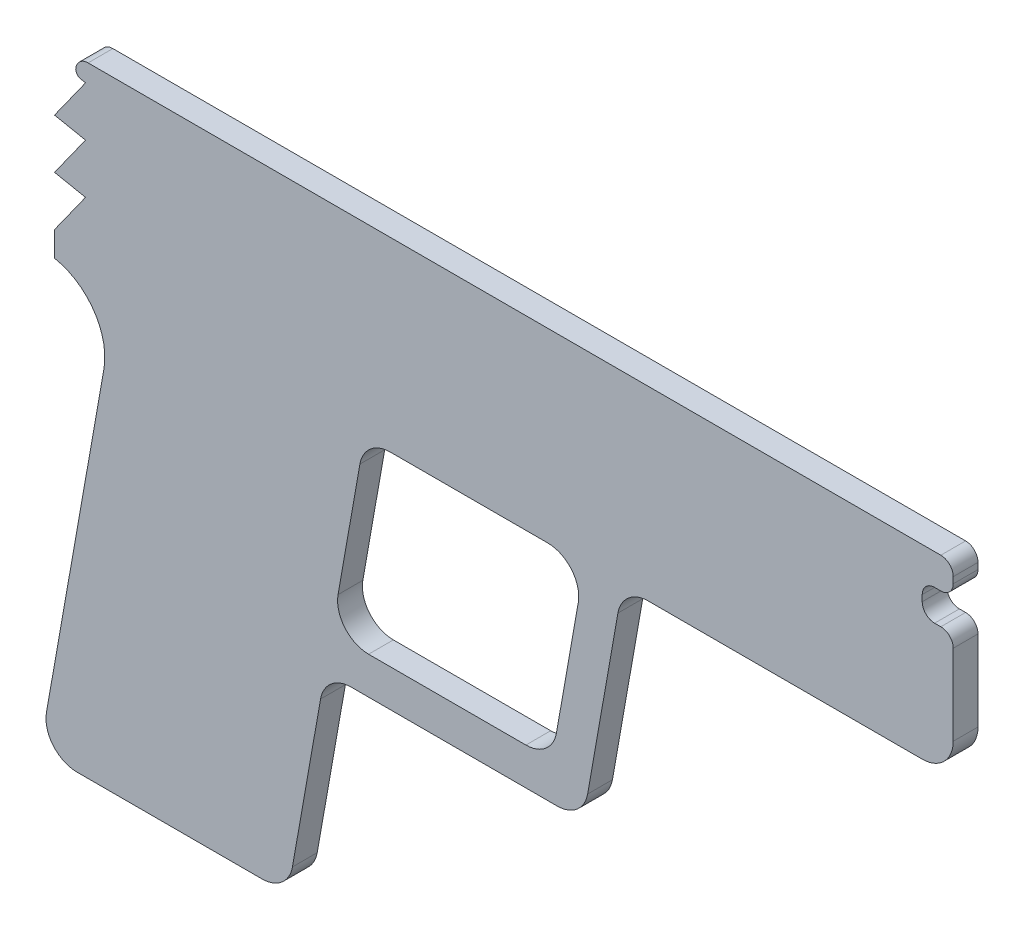
from build123d import *

# Parameters (mm, degrees)
BOSS_EXTRUDE1_DEPTH = 4
FILLET1_R           = 10
FILLET2_R           = 5
CUT_EXTRUDE1_DEPTH  = 4
LPATTERN1_COUNT     = 3
LPATTERN1_PITCH     = 8
FILLET3_R           = 2
FILLET4_R           = 2
CUT_EXTRUDE2_DEPTH  = 10
FILLET5_R           = 2
FILLET6_R           = 1


with BuildPart() as part:
    # Sketch1 → Boss-Extrude1 (new body)
    with BuildSketch(Plane.XY):
        Polygon((10, 0), (-2.34288865, -70), (37.65711135, -70), (43.652228694, -36), (85.284719782, -36), (91.632491087, 0), (145, 0), (145, 20), (140, 20), (140, 25), (145, 25), (145, 30), (0, 30), (0, 0), align=None)
        Polygon((44.710190579, -30), (80.250121995, -30), (85.539931416, 0), (50, 0), align=None, mode=Mode.SUBTRACT)
    extrude(amount=BOSS_EXTRUDE1_DEPTH)

    # Fillet1
    # the kernel refuses this fillet: 10 mm, written as the material it adds along each edge
    with BuildSketch(Plane(origin=(10, 0, 0), x_dir=(-0.17364817766693433, -0.9848077530122074, 0), z_dir=(0, 0, 1))) as fillet1_piece_1:
        with BuildLine():
            CenterArc((11.735327688, -10), FILLET1_R, 90, 89.129514879)
            Line((1.736481777, -9.84807753), (1.536504858, -9.845039081))
            ThreePointArc((1.536504858, -9.845039081), (0.671279338, -4.958768401), (-0.196961551, -0.034729636))
            Line((-0.196961551, -0.034729636), (0, 0.2))
            Line((0, 0.2), (11.735327688, 0.2))
            Line((11.735327688, 0.2), (11.735327688, 0))
        make_face()
    extrude(amount=4)

    # Fillet2
    fillet2_edges = [part.edges().sort_by_distance(p)[0] for p in [
        (145, 0, 2),
        (91.632491087, 0, 2),
        (85.284719782, -36, 2),
        (43.652228694, -36, 2),
        (37.65711135, -70, 2),
        (-2.34288865, -70, 2),
        (85.539931416, 0, 2),
        (50, 0, 2),
        (44.710190579, -30, 2),
        (80.250121995, -30, 2),
    ]]
    fillet(fillet2_edges, radius=FILLET2_R)

    # Sketch2 → Cut-Extrude1 (cut)
    with BuildSketch(Plane.XY.offset(4)):
        Polygon((0, 20), (0, 28), (5, 27), align=None)
    cut_extrude1 = extrude(amount=-CUT_EXTRUDE1_DEPTH, mode=Mode.SUBTRACT)

    # LPattern1: Cut-Extrude1 ×3
    with Locations(*[(0, -i * LPATTERN1_PITCH, 0) for i in range(1, LPATTERN1_COUNT)]):
        add(cut_extrude1, mode=Mode.SUBTRACT)

    # Fillet3
    fillet3_edges = [part.edges().sort_by_distance(p)[0] for p in [
        (145, 25, 2),
        (140, 25, 2),
        (140, 20, 2),
        (145, 20, 2),
    ]]
    fillet(fillet3_edges, radius=FILLET3_R)

    # Fillet4
    fillet4_edges = [part.edges().sort_by_distance(p)[0] for p in [
        (145, 30, 2),
    ]]
    fillet(fillet4_edges, radius=FILLET4_R)

    # Sketch3 → Cut-Extrude2 (cut)
    with BuildSketch(Plane.XY.offset(4)):
        Polygon((3.410578707, 27.317884259), (3.410578707, 32.702988903), (-2.245047392, 32.702988903), (-2.245047392, 26.199863932), align=None)
    extrude(amount=-CUT_EXTRUDE2_DEPTH, mode=Mode.SUBTRACT)

    # Fillet5
    fillet5_edges = [part.edges().sort_by_distance(p)[0] for p in [
        (3.410578707, 30, 2),
    ]]
    fillet(fillet5_edges, radius=FILLET5_R)

    # Fillet6
    fillet6_edges = [part.edges().sort_by_distance(p)[0] for p in [
        (3.410578707, 27.317884259, 2),
    ]]
    fillet(fillet6_edges, radius=FILLET6_R)


solid = part.part
